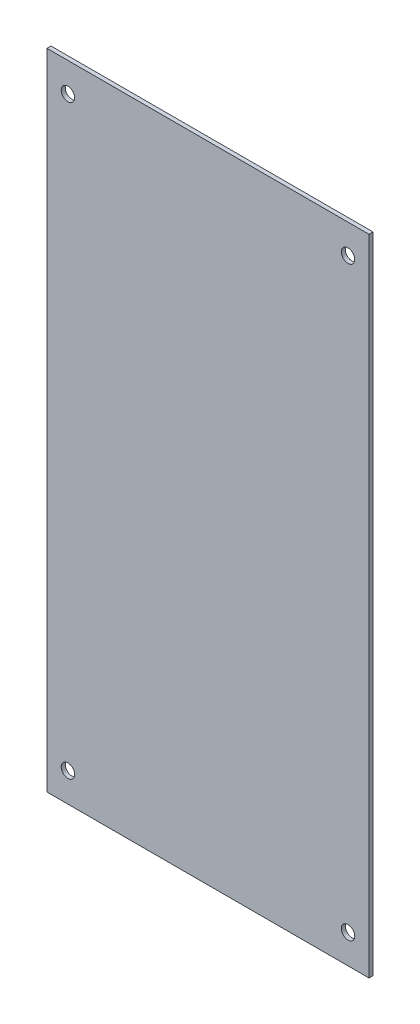
from build123d import *

# Parameters (mm, degrees)
SKETCH1_W           = 609.6
SKETCH1_H           = 1219.2
BOSS_EXTRUDE2_DEPTH = 7.62
SKETCH2_R           = 12.7
CUT_EXTRUDE1_DEPTH  = 898.288207649


with BuildPart() as part:
    # Sketch1 → Boss-Extrude2 (new body)
    with BuildSketch(Plane.XY):
        with Locations((-235.216388841, -106.954508024)):
            Rectangle(SKETCH1_W, SKETCH1_H)
    extrude(amount=BOSS_EXTRUDE2_DEPTH)

    # Sketch2 → Cut-Extrude1 (cut, through all)
    with BuildSketch(Plane.XY.offset(7.62)):
        with Locations((-500.326635101, 447.717900414)):
            Circle(SKETCH2_R)
        with Locations((29.893857419, 447.717900414)):
            Circle(SKETCH2_R)
        with Locations((-500.326635101, -661.626916461)):
            Circle(SKETCH2_R)
        with Locations((29.893857419, -661.626916461)):
            Circle(SKETCH2_R)
    extrude(amount=-CUT_EXTRUDE1_DEPTH, mode=Mode.SUBTRACT)


solid = part.part
